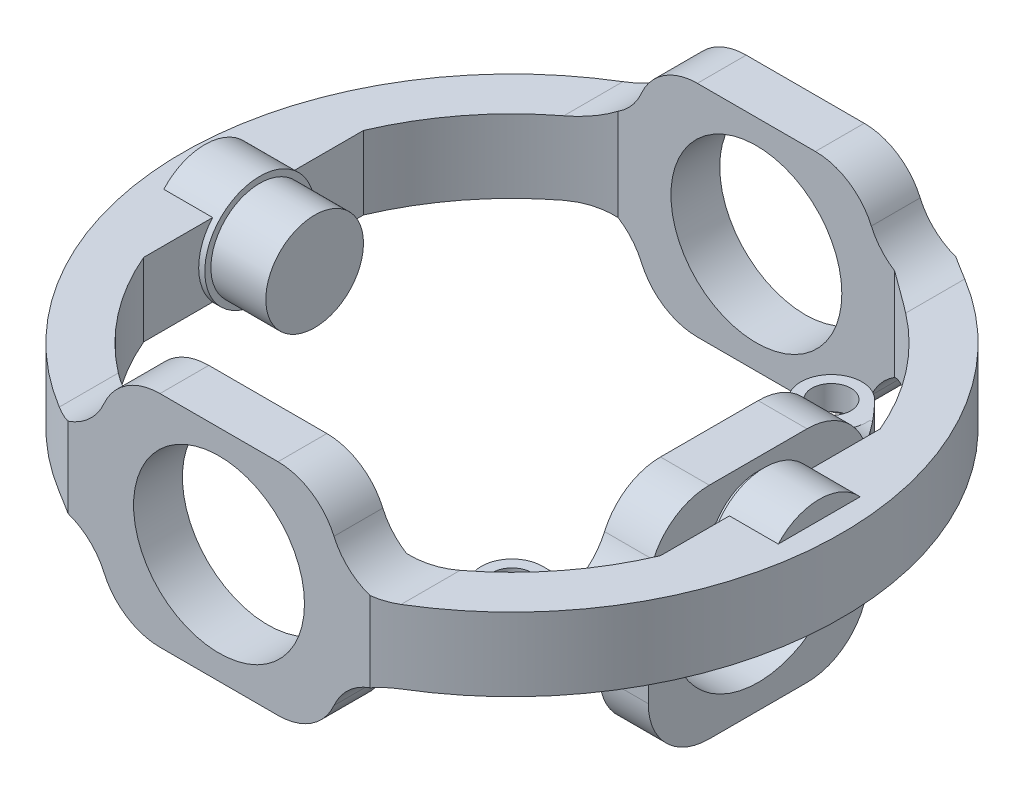
from build123d import *

# Parameters (mm, degrees)
MOTOR_START                                 = -10
MOTOR_BEARING_MOUNT_NO_HORN_FILLET7_OU_W    = 4
MOTOR_BEARING_MOUNT_NO_HORN_FILLET7_OU_H    = 18
MOTOR_BEARING_MOUNT_NO_HORN_FILLET7_DEPTH   = 18
MOTOR_BEARING_MOUNT_NO_HORN_FILLET_2_R      = 1.6
MOTOR_BEARING_MOUNT_NO_HORN_FILLET7_2_DEPTH = 4.233863101
MOTOR_START_2                               = 10
MOTOR_BEARING_MOUNT_NO_HORN_FILLET_3_R      = 7
MOTOR_BEARING_MOUNT_NO_HORN_FILLET7_3_DEPTH = 10.163229875
MOTOR_BEARING_MOUNT_NO_HORN_FILLET7_4_DEPTH = 6.163229875
SKETCH6_R                                   = 27
SKETCH6_R_2                                 = 23
BOSS_EXTRUDE1_DEPTH                         = 6
SKETCH7_R                                   = 4
BOSS_EXTRUDE2_DEPTH                         = 5
SKETCH8_R                                   = 4
BOSS_EXTRUDE3_DEPTH                         = 5
BOSS_EXTRUDE4_DEPTH                         = 0.5
BOSS_EXTRUDE4_DEPTH_BACK                    = 4
SKETCH9_R                                   = 4.5
BOSS_EXTRUDE5_DEPTH                         = 0.5
BOSS_EXTRUDE5_DEPTH_BACK                    = 4
SKETCH10_R                                  = 4.5
BOSS_EXTRUDE6_DEPTH                         = 6
SKETCH12_W                                  = 105.724741705
SKETCH12_H                                  = 65.482936879
SKETCH12_W_2                                = 68.269728532
SKETCH12_H_2                                = 48.01835408
CUT_EXTRUDE1_DEPTH                          = 6
BOSS_EXTRUDE7_DEPTH                         = 6
BOSS_EXTRUDE7_DEPTH_BACK                    = 12
SKETCH13_W                                  = 18
SKETCH13_H                                  = 4
CUT_EXTRUDE2_REACH                          = 58.381
SKETCH14_R                                  = 7
FILLET1_R                                   = 5
FILLET2_R                                   = 5


with BuildPart() as part:
    # <Motor Bearing Mount No Horn>-<Fillet7>: read off the stored shape, not the designer's step
    # <Motor Bearing Mount No Horn>-<Fillet7> ou → <Motor Bearing Mount No Horn>-<Fillet7> (new body)
    with BuildSketch(Plane(origin=(0, 0, 0), x_dir=(1, 0, 0), z_dir=(0, 1, 0)).offset(MOTOR_START)):
        with Locations((18.163229875, 0)):
            Rectangle(MOTOR_BEARING_MOUNT_NO_HORN_FILLET7_OU_W, MOTOR_BEARING_MOUNT_NO_HORN_FILLET7_OU_H)
    extrude(amount=MOTOR_BEARING_MOUNT_NO_HORN_FILLET7_DEPTH)

    # Motor Bearing Mount No Horn_-_Fillet 2 → Motor Bearing Mount No Horn_-_Fillet7 2 (add)
    # profile 1 of 2: a face of its own
    with BuildSketch(Plane(origin=(0, 0, 0), x_dir=(1, 0, 0), z_dir=(0, 1, 0))):
        with BuildLine():
            ThreePointArc((16.861305488, -12.517842356), (18.410904773, -10.663779717), (20.163229875, -9))
            Line((20.163229875, -9), (16.163229875, -9))
            Line((16.163229875, -9), (16.163229875, -7.591593953))
            ThreePointArc((16.163229875, -7.591593953), (16.095478885, -8.411910787), (15.894061993, -9.209996709))
            ThreePointArc((15.894061993, -9.209996709), (15.225402253, -10.14460404), (14.152747844, -10.556925794))
            ThreePointArc((14.152747844, -10.556925794), (13.649049258, -10.582314386), (13.144711232, -10.582275333))
            ThreePointArc((13.144711232, -10.582275333), (10.759860766, -14.008894046), (14.849242405, -14.849242405))
            ThreePointArc((14.849242405, -14.849242405), (15.898068073, -13.720474902), (16.861305488, -12.517842356))
        make_face()
        with Locations((13.081475452, -13.081475452)):
            Circle(MOTOR_BEARING_MOUNT_NO_HORN_FILLET_2_R, mode=Mode.SUBTRACT)
    # profile 2 of 2: a face of its own
    with BuildSketch(Plane(origin=(0, 0, 0), x_dir=(1, 0, 0), z_dir=(0, 1, 0))):
        with BuildLine():
            Line((16.163229875, 9), (20.163229875, 9))
            ThreePointArc((20.163229875, 9), (18.410904773, 10.663779717), (16.861305488, 12.517842356))
            ThreePointArc((16.861305488, 12.517842356), (15.898068073, 13.720474902), (14.849242405, 14.849242405))
            ThreePointArc((14.849242405, 14.849242405), (10.759860766, 14.008894046), (13.144711232, 10.582275333))
            ThreePointArc((13.144711232, 10.582275333), (13.649049258, 10.582314386), (14.152747844, 10.556925794))
            ThreePointArc((14.152747844, 10.556925794), (15.225402253, 10.14460404), (15.894061993, 9.209996709))
            ThreePointArc((15.894061993, 9.209996709), (16.095478885, 8.411910787), (16.163229875, 7.591593953))
            Line((16.163229875, 7.591593953), (16.163229875, 9))
        make_face()
        with Locations((13.081475452, 13.081475452)):
            Circle(MOTOR_BEARING_MOUNT_NO_HORN_FILLET_2_R, mode=Mode.SUBTRACT)
    extrude(amount=MOTOR_BEARING_MOUNT_NO_HORN_FILLET7_2_DEPTH)

    # Motor Bearing Mount No Horn_-_Fillet 3 → Motor Bearing Mount No Horn_-_Fillet7 3 (cut)
    with BuildSketch(Plane.YZ.offset(MOTOR_START_2)):
        with BuildLine():
            Line((2, 17), (2, 13.16515139))
            ThreePointArc((2, 13.16515139), (2.593715587, 10.801963357), (4.23386307, 8.999999954))
            Line((4.23386307, 8.999999954), (4.233863101, 17))
            Line((4.233863101, 17), (2, 17))
        make_face()
        with BuildLine():
            Line((8, 9), (4.23386307, 8.999999954))
            ThreePointArc((4.23386307, 8.999999954), (4.607809359, 8.774545061), (5, 8.582575695))
            ThreePointArc((5, 8.582575695), (7.183300133, 6.738612788), (8, 4))
            Line((8, 4), (8, 9))
        make_face()
        with Locations((-1, 0)):
            Circle(MOTOR_BEARING_MOUNT_NO_HORN_FILLET_3_R)
        with BuildLine():
            ThreePointArc((-10, 4), (-8.535533906, 7.535533906), (-5, 9))
            Line((-5, 9), (-10, 9))
            Line((-10, 9), (-10, 4))
        make_face()
        with BuildLine():
            Line((8, -9), (8, -4))
            ThreePointArc((8, -4), (7.183300133, -6.738612788), (5, -8.582575695))
            ThreePointArc((5, -8.582575695), (4.607809359, -8.774545061), (4.23386307, -8.999999954))
            Line((4.23386307, -8.999999954), (8, -9))
        make_face()
        with BuildLine():
            ThreePointArc((-5, -9), (-8.535533906, -7.535533906), (-10, -4))
            Line((-10, -4), (-10, -9))
            Line((-10, -9), (-5, -9))
        make_face()
        with BuildLine():
            Line((4.233863101, -17), (4.23386307, -8.999999954))
            ThreePointArc((4.23386307, -8.999999954), (2.593715587, -10.801963357), (2, -13.16515139))
            Line((2, -13.16515139), (2, -17))
            Line((2, -17), (4.233863101, -17))
        make_face()
    extrude(amount=MOTOR_BEARING_MOUNT_NO_HORN_FILLET7_3_DEPTH, mode=Mode.SUBTRACT)

    # Motor Bearing Mount No Horn_-_Fillet 4 → Motor Bearing Mount No Horn_-_Fillet7 4 (cut)
    with BuildSketch(Plane.YZ.offset(MOTOR_START_2)):
        with BuildLine():
            ThreePointArc((4.23386307, 8.999999954), (2.593715587, 10.801963357), (2, 13.16515139))
            Line((2, 13.16515139), (2, 6.32455532))
            ThreePointArc((2, 6.32455532), (3.201378916, 5.598965548), (4.233863101, 4.648298295))
            Line((4.233863101, 4.648298295), (4.23386307, 8.999999954))
        make_face()
        with BuildLine():
            ThreePointArc((4.233863101, -4.648298295), (3.201378916, -5.598965548), (2, -6.32455532))
            Line((2, -6.32455532), (2, -13.16515139))
            ThreePointArc((2, -13.16515139), (2.593715587, -10.801963357), (4.23386307, -8.999999954))
            Line((4.23386307, -8.999999954), (4.233863101, -4.648298295))
        make_face()
    extrude(amount=MOTOR_BEARING_MOUNT_NO_HORN_FILLET7_4_DEPTH, mode=Mode.SUBTRACT)


with BuildPart() as body_2:
    # Sketch6 → Boss-Extrude1 (new body)
    # profile 1 of 3: a face of its own
    with BuildSketch(Plane(origin=(0, 0, 0), x_dir=(1, 0, 0), z_dir=(0, 1, 0))):
        with Locations(Location((0, 0, 0), (0, 0, 270))):
            Circle(SKETCH6_R)
        Circle(SKETCH6_R_2, mode=Mode.SUBTRACT)
    # profile 2 of 3: a face of its own
    with BuildSketch(Plane(origin=(0, 0, 0), x_dir=(1, 0, 0), z_dir=(0, 1, 0))):
        with BuildLine():
            Line((-21.166010489, -9), (-21.166010489, 9))
            ThreePointArc((-21.166010489, 9), (-23, 0), (-21.166010489, -9))
        make_face()
    # profile 3 of 3: a face of its own
    with BuildSketch(Plane(origin=(0, 0, 0), x_dir=(1, 0, 0), z_dir=(0, 1, 0))):
        with BuildLine():
            ThreePointArc((23, 0), (22.536839189, 4.592480744), (21.166010489, 9))
            Line((21.166010489, 9), (21.166010489, -9))
            ThreePointArc((21.166010489, -9), (22.536839189, -4.592480744), (23, 0))
        make_face()
    extrude(amount=BOSS_EXTRUDE1_DEPTH)

    # Sketch7 → Boss-Extrude2 (add)
    with BuildSketch(Plane.ZY.offset(-21.166010489)):
        with Locations(Location((0, 3, 0), (0, 0, 131.409622109))):
            Circle(SKETCH7_R)
    extrude(amount=BOSS_EXTRUDE2_DEPTH)

    # Sketch8 → Boss-Extrude3 (add)
    with BuildSketch(Plane(origin=(-21.166010489, 0, 0), x_dir=(0, 0, -1), z_dir=(1, 0, 0))):
        with Locations(Location((0, 3, 0), (0, 0, 48.590377891))):
            Circle(SKETCH8_R)
    extrude(amount=BOSS_EXTRUDE3_DEPTH)

    # Sketch9 → Boss-Extrude4 (add, two sides: drawn at the far end of the back side and taken through both)
    with BuildSketch(Plane(origin=(-21.166010489, 0, 0), x_dir=(0, 0, -1), z_dir=(1, 0, 0)).offset(-BOSS_EXTRUDE4_DEPTH_BACK)):
        with Locations((0, 3)):
            Circle(SKETCH9_R)
    extrude(amount=BOSS_EXTRUDE4_DEPTH + BOSS_EXTRUDE4_DEPTH_BACK)

    # Sketch10 → Boss-Extrude5 (add, two sides: drawn at the far end of the back side and taken through both)
    with BuildSketch(Plane.ZY.offset(-21.166010489).offset(-BOSS_EXTRUDE5_DEPTH_BACK)):
        with Locations(Location((0, 3, 0), (0, 0, 180))):
            Circle(SKETCH10_R)
    extrude(amount=BOSS_EXTRUDE5_DEPTH + BOSS_EXTRUDE5_DEPTH_BACK)

    # Sketch11 → Boss-Extrude6 (add)
    with BuildSketch(Plane(origin=(0, 6, 0), x_dir=(1, 0, 0), z_dir=(0, 1, 0))):
        with BuildLine():
            ThreePointArc((11.325435971, 20.01835408), (0, 23), (-11.325435971, 20.01835408))
            Line((-11.325435971, 20.01835408), (11.325435971, 20.01835408))
        make_face()
        with BuildLine():
            Line((0, -20), (-11.357816692, -20))
            ThreePointArc((-11.357816692, -20), (0, -23), (11.357816692, -20))
            Line((11.357816692, -20), (0, -20))
        make_face()
    extrude(amount=-BOSS_EXTRUDE6_DEPTH)

    # Sketch12 → Cut-Extrude1 (cut)
    with BuildSketch(Plane(origin=(0, 6, 0), x_dir=(1, 0, 0), z_dir=(0, 1, 0))):
        with Locations((2.340104953, -2.120095085)):
            Rectangle(SKETCH12_W, SKETCH12_H)
        with Locations((1.133384165, 0.00917704)):
            Rectangle(SKETCH12_W_2, SKETCH12_H_2, mode=Mode.SUBTRACT)
    extrude(amount=-CUT_EXTRUDE1_DEPTH, mode=Mode.SUBTRACT)

    # Sketch13 → Boss-Extrude7 (add, two sides: drawn at the far end of the back side and taken through both)
    with BuildSketch(Plane(origin=(0, 6, 0), x_dir=(1, 0, 0), z_dir=(0, 1, 0)).offset(-BOSS_EXTRUDE7_DEPTH_BACK)):
        with Locations((0, -22)):
            Rectangle(SKETCH13_W, SKETCH13_H)
        with Locations((0, 22.01835408)):
            Rectangle(SKETCH13_W, SKETCH13_H)
    extrude(amount=BOSS_EXTRUDE7_DEPTH + BOSS_EXTRUDE7_DEPTH_BACK)

    # Cut-Extrude2: up to this face of the body (flat: up to its plane)
    cut_extrude2_end = Plane(body_2.part.faces().sort_by_distance((0, 3, -24.01835408))[0])
    # Sketch14 → Cut-Extrude2 (cut, up to the picked face)
    with BuildSketch(Plane.XY.offset(24), mode=Mode.PRIVATE) as cut_extrude2_sk1:
        with Locations((0, 3)):
            Circle(SKETCH14_R)
    cut_extrude2_tool1 = split(extrude(cut_extrude2_sk1.sketch, amount=-CUT_EXTRUDE2_REACH, mode=Mode.PRIVATE), bisect_by=cut_extrude2_end, keep=Keep.BOTH, mode=Mode.PRIVATE)
    add(cut_extrude2_tool1.solids().sort_by(Axis((0, 3, 24), (0, 0, -1)))[0], mode=Mode.SUBTRACT)

    # Fillet1
    # the kernel refuses this fillet: 5 mm, written as the material it adds along each edge
    with BuildSketch(Plane(origin=(-9, 0, 20), x_dir=(-1, 0, 0), z_dir=(0, 0, 1))) as fillet1_piece_1_section:
        with BuildLine():
            CenterArc((FILLET1_R, FILLET1_R), FILLET1_R, 180, 90)
            Line((0, FILLET1_R), (0, 0))
            Line((0, 0), (FILLET1_R, 0))
        make_face()
    fillet1_piece_1 = extrude(amount=4, mode=Mode.PRIVATE)
    fillet1_piece_1 = fillet1_piece_1 & Plane(origin=(0, 0, 0), x_dir=(1, 0, 0), z_dir=(0, -1, 0)) * Cylinder(23, 28, mode=Mode.PRIVATE)
    add(fillet1_piece_1)
    with BuildSketch(Plane(origin=(-9, 0, 7.5), x_dir=(-1, 0, 0), z_dir=(0, 0, 1))) as fillet1_piece_2_section:
        with BuildLine():
            CenterArc((FILLET1_R, FILLET1_R), FILLET1_R, 180, 90)
            Line((0, FILLET1_R), (0, 0))
            Line((0, 0), (FILLET1_R, 0))
        make_face()
    fillet1_piece_2 = extrude(amount=16.5, mode=Mode.PRIVATE)
    fillet1_piece_2 = split(fillet1_piece_2, bisect_by=Plane(origin=(-9, 0, 20), z_dir=(0, 0, -1)), keep=Keep.TOP, mode=Mode.PRIVATE)
    fillet1_piece_2 = fillet1_piece_2 - Plane(origin=(0, 0, 0), x_dir=(1, 0, 0), z_dir=(0, -1, 0)) * Cylinder(23, 53, mode=Mode.PRIVATE)
    add(fillet1_piece_2)
    with BuildSketch(Plane(origin=(-9, 0, 20), x_dir=(-1, 0, 0), z_dir=(0, 0, 1))) as fillet1_piece_3_section:
        with BuildLine():
            CenterArc((FILLET1_R, FILLET1_R), FILLET1_R, 180, 90)
            Line((0, FILLET1_R), (0, 0))
            Line((0, 0), (FILLET1_R, 0))
        make_face()
    fillet1_piece_3 = extrude(amount=4, mode=Mode.PRIVATE)
    fillet1_piece_3 = fillet1_piece_3 & Plane(origin=(0, 0, 0), x_dir=(0, 0, 1), z_dir=(0, -1, 0)) * Cylinder(27, 28, mode=Mode.PRIVATE)
    fillet1_piece_3 = fillet1_piece_3 - Plane(origin=(0, 0, 0), x_dir=(1, 0, 0), z_dir=(0, -1, 0)) * Cylinder(23, 28, mode=Mode.PRIVATE)
    add(fillet1_piece_3)
    with BuildSketch(Plane(origin=(9, 0, 24), x_dir=(1, 0, 0), z_dir=(0, 0, -1))) as fillet1_piece_4_section:
        with BuildLine():
            CenterArc((FILLET1_R, FILLET1_R), FILLET1_R, 180, 90)
            Line((0, FILLET1_R), (0, 0))
            Line((0, 0), (FILLET1_R, 0))
        make_face()
    fillet1_piece_4 = extrude(amount=4, mode=Mode.PRIVATE)
    fillet1_piece_4 = fillet1_piece_4 & Plane(origin=(0, 0, 0), x_dir=(0, 0, 1), z_dir=(0, -1, 0)) * Cylinder(27, 28, mode=Mode.PRIVATE)
    fillet1_piece_4 = fillet1_piece_4 - Plane(origin=(0, 0, 0), x_dir=(1, 0, 0), z_dir=(0, -1, 0)) * Cylinder(23, 28, mode=Mode.PRIVATE)
    add(fillet1_piece_4)
    with BuildSketch(Plane(origin=(9, 0, 24), x_dir=(1, 0, 0), z_dir=(0, 0, -1))) as fillet1_piece_5_section:
        with BuildLine():
            CenterArc((FILLET1_R, FILLET1_R), FILLET1_R, 180, 90)
            Line((0, FILLET1_R), (0, 0))
            Line((0, 0), (FILLET1_R, 0))
        make_face()
    fillet1_piece_5 = extrude(amount=4, mode=Mode.PRIVATE)
    fillet1_piece_5 = fillet1_piece_5 & Plane(origin=(0, 0, 0), x_dir=(1, 0, 0), z_dir=(0, -1, 0)) * Cylinder(23, 28, mode=Mode.PRIVATE)
    add(fillet1_piece_5)
    with BuildSketch(Plane(origin=(9, 0, 24), x_dir=(1, 0, 0), z_dir=(0, 0, -1))) as fillet1_piece_6_section:
        with BuildLine():
            CenterArc((FILLET1_R, FILLET1_R), FILLET1_R, 180, 90)
            Line((0, FILLET1_R), (0, 0))
            Line((0, 0), (FILLET1_R, 0))
        make_face()
    fillet1_piece_6 = extrude(amount=16.5, mode=Mode.PRIVATE)
    fillet1_piece_6 = split(fillet1_piece_6, bisect_by=Plane(origin=(9, 0, 20), z_dir=(0, 0, -1)), keep=Keep.TOP, mode=Mode.PRIVATE)
    fillet1_piece_6 = fillet1_piece_6 - Plane(origin=(0, 0, 0), x_dir=(1, 0, 0), z_dir=(0, -1, 0)) * Cylinder(23, 53, mode=Mode.PRIVATE)
    add(fillet1_piece_6)
    with BuildSketch(Plane(origin=(-9, 6, 20), x_dir=(-1, 0, 0), z_dir=(0, 0, 1))) as fillet1_piece_7_section:
        with BuildLine():
            CenterArc((FILLET1_R, -FILLET1_R), FILLET1_R, 90, 90)
            Line((0, -FILLET1_R), (0, 0))
            Line((0, 0), (FILLET1_R, 0))
        make_face()
    fillet1_piece_7 = extrude(amount=4, mode=Mode.PRIVATE)
    fillet1_piece_7 = fillet1_piece_7 & Plane(origin=(0, 6, 0), x_dir=(1, 0, 0), z_dir=(0, -1, 0)) * Cylinder(23, 28, mode=Mode.PRIVATE)
    add(fillet1_piece_7)
    with BuildSketch(Plane(origin=(-9, 6, 7.5), x_dir=(-1, 0, 0), z_dir=(0, 0, 1))) as fillet1_piece_8_section:
        with BuildLine():
            CenterArc((FILLET1_R, -FILLET1_R), FILLET1_R, 90, 90)
            Line((0, -FILLET1_R), (0, 0))
            Line((0, 0), (FILLET1_R, 0))
        make_face()
    fillet1_piece_8 = extrude(amount=16.5, mode=Mode.PRIVATE)
    fillet1_piece_8 = split(fillet1_piece_8, bisect_by=Plane(origin=(-9, 6, 20), z_dir=(0, 0, -1)), keep=Keep.TOP, mode=Mode.PRIVATE)
    fillet1_piece_8 = fillet1_piece_8 - Plane(origin=(0, 6, 0), x_dir=(1, 0, 0), z_dir=(0, -1, 0)) * Cylinder(23, 53, mode=Mode.PRIVATE)
    add(fillet1_piece_8)
    with BuildSketch(Plane(origin=(-9, 6, 20), x_dir=(-1, 0, 0), z_dir=(0, 0, 1))) as fillet1_piece_9_section:
        with BuildLine():
            CenterArc((FILLET1_R, -FILLET1_R), FILLET1_R, 90, 90)
            Line((0, -FILLET1_R), (0, 0))
            Line((0, 0), (FILLET1_R, 0))
        make_face()
    fillet1_piece_9 = extrude(amount=4, mode=Mode.PRIVATE)
    fillet1_piece_9 = fillet1_piece_9 & Plane(origin=(0, 6, 0), x_dir=(0, 0, 1), z_dir=(0, -1, 0)) * Cylinder(27, 28, mode=Mode.PRIVATE)
    fillet1_piece_9 = fillet1_piece_9 - Plane(origin=(0, 6, 0), x_dir=(1, 0, 0), z_dir=(0, -1, 0)) * Cylinder(23, 28, mode=Mode.PRIVATE)
    add(fillet1_piece_9)
    with BuildSketch(Plane(origin=(9, 6, 24), x_dir=(1, 0, 0), z_dir=(0, 0, -1))) as fillet1_piece_10_section:
        with BuildLine():
            CenterArc((FILLET1_R, -FILLET1_R), FILLET1_R, 90, 90)
            Line((0, -FILLET1_R), (0, 0))
            Line((0, 0), (FILLET1_R, 0))
        make_face()
    fillet1_piece_10 = extrude(amount=4, mode=Mode.PRIVATE)
    fillet1_piece_10 = fillet1_piece_10 & Plane(origin=(0, 6, 0), x_dir=(0, 0, 1), z_dir=(0, -1, 0)) * Cylinder(27, 28, mode=Mode.PRIVATE)
    fillet1_piece_10 = fillet1_piece_10 - Plane(origin=(0, 6, 0), x_dir=(1, 0, 0), z_dir=(0, -1, 0)) * Cylinder(23, 28, mode=Mode.PRIVATE)
    add(fillet1_piece_10)
    with BuildSketch(Plane(origin=(9, 6, 24), x_dir=(1, 0, 0), z_dir=(0, 0, -1))) as fillet1_piece_11_section:
        with BuildLine():
            CenterArc((FILLET1_R, -FILLET1_R), FILLET1_R, 90, 90)
            Line((0, -FILLET1_R), (0, 0))
            Line((0, 0), (FILLET1_R, 0))
        make_face()
    fillet1_piece_11 = extrude(amount=4, mode=Mode.PRIVATE)
    fillet1_piece_11 = fillet1_piece_11 & Plane(origin=(0, 6, 0), x_dir=(1, 0, 0), z_dir=(0, -1, 0)) * Cylinder(23, 28, mode=Mode.PRIVATE)
    add(fillet1_piece_11)
    with BuildSketch(Plane(origin=(9, 6, 24), x_dir=(1, 0, 0), z_dir=(0, 0, -1))) as fillet1_piece_12_section:
        with BuildLine():
            CenterArc((FILLET1_R, -FILLET1_R), FILLET1_R, 90, 90)
            Line((0, -FILLET1_R), (0, 0))
            Line((0, 0), (FILLET1_R, 0))
        make_face()
    fillet1_piece_12 = extrude(amount=16.5, mode=Mode.PRIVATE)
    fillet1_piece_12 = split(fillet1_piece_12, bisect_by=Plane(origin=(9, 6, 20), z_dir=(0, 0, -1)), keep=Keep.TOP, mode=Mode.PRIVATE)
    fillet1_piece_12 = fillet1_piece_12 - Plane(origin=(0, 6, 0), x_dir=(1, 0, 0), z_dir=(0, -1, 0)) * Cylinder(23, 53, mode=Mode.PRIVATE)
    add(fillet1_piece_12)
    with BuildSketch(Plane(origin=(-9, 0, -24.01835408), x_dir=(0, -1, 0), z_dir=(0, 0, 1))) as fillet1_piece_13_section:
        with BuildLine():
            CenterArc((FILLET1_R, -FILLET1_R), FILLET1_R, 90, 90)
            Line((0, -FILLET1_R), (0, 0))
            Line((0, 0), (FILLET1_R, 0))
        make_face()
    fillet1_piece_13 = extrude(amount=4, mode=Mode.PRIVATE)
    fillet1_piece_13 = fillet1_piece_13 & Plane(origin=(0, 0, 0), x_dir=(0, 0, 1), z_dir=(0, -1, 0)) * Cylinder(27, 28, mode=Mode.PRIVATE)
    fillet1_piece_13 = fillet1_piece_13 - Plane(origin=(0, 0, 0), x_dir=(1, 0, 0), z_dir=(0, -1, 0)) * Cylinder(23, 28, mode=Mode.PRIVATE)
    add(fillet1_piece_13)
    with BuildSketch(Plane(origin=(-9, 0, -24.01835408), x_dir=(0, -1, 0), z_dir=(0, 0, 1))) as fillet1_piece_14_section:
        with BuildLine():
            CenterArc((FILLET1_R, -FILLET1_R), FILLET1_R, 90, 90)
            Line((0, -FILLET1_R), (0, 0))
            Line((0, 0), (FILLET1_R, 0))
        make_face()
    fillet1_piece_14 = extrude(amount=16.5, mode=Mode.PRIVATE)
    fillet1_piece_14 = split(fillet1_piece_14, bisect_by=Plane(origin=(-9, 0, -20.01835408), z_dir=(0, 0, 1)), keep=Keep.TOP, mode=Mode.PRIVATE)
    fillet1_piece_14 = fillet1_piece_14 - Plane(origin=(0, 0, 0), x_dir=(1, 0, 0), z_dir=(0, -1, 0)) * Cylinder(23, 53, mode=Mode.PRIVATE)
    add(fillet1_piece_14)
    with BuildSketch(Plane(origin=(-9, 0, -24.01835408), x_dir=(0, -1, 0), z_dir=(0, 0, 1))) as fillet1_piece_15_section:
        with BuildLine():
            CenterArc((FILLET1_R, -FILLET1_R), FILLET1_R, 90, 90)
            Line((0, -FILLET1_R), (0, 0))
            Line((0, 0), (FILLET1_R, 0))
        make_face()
    fillet1_piece_15 = extrude(amount=4, mode=Mode.PRIVATE)
    fillet1_piece_15 = fillet1_piece_15 & Plane(origin=(0, 0, 0), x_dir=(1, 0, 0), z_dir=(0, -1, 0)) * Cylinder(23, 28, mode=Mode.PRIVATE)
    add(fillet1_piece_15)
    with BuildSketch(Plane(origin=(9, 0, -20.01835408), x_dir=(1, 0, 0), z_dir=(0, 0, -1))) as fillet1_piece_16_section:
        with BuildLine():
            CenterArc((FILLET1_R, FILLET1_R), FILLET1_R, 180, 90)
            Line((0, FILLET1_R), (0, 0))
            Line((0, 0), (FILLET1_R, 0))
        make_face()
    fillet1_piece_16 = extrude(amount=4, mode=Mode.PRIVATE)
    fillet1_piece_16 = fillet1_piece_16 & Plane(origin=(0, 0, 0), x_dir=(1, 0, 0), z_dir=(0, -1, 0)) * Cylinder(23, 28, mode=Mode.PRIVATE)
    add(fillet1_piece_16)
    with BuildSketch(Plane(origin=(9, 0, -7.51835408), x_dir=(1, 0, 0), z_dir=(0, 0, -1))) as fillet1_piece_17_section:
        with BuildLine():
            CenterArc((FILLET1_R, FILLET1_R), FILLET1_R, 180, 90)
            Line((0, FILLET1_R), (0, 0))
            Line((0, 0), (FILLET1_R, 0))
        make_face()
    fillet1_piece_17 = extrude(amount=16.5, mode=Mode.PRIVATE)
    fillet1_piece_17 = fillet1_piece_17 - Plane(origin=(0, 0, 0), x_dir=(1, 0, 0), z_dir=(0, -1, 0)) * Cylinder(23, 53, mode=Mode.PRIVATE)
    fillet1_piece_17 = split(fillet1_piece_17, bisect_by=Plane(origin=(9, 0, -20.01835408), z_dir=(0, 0, 1)), keep=Keep.TOP, mode=Mode.PRIVATE)
    add(fillet1_piece_17)
    with BuildSketch(Plane(origin=(9, 0, -20.01835408), x_dir=(1, 0, 0), z_dir=(0, 0, -1))) as fillet1_piece_18_section:
        with BuildLine():
            CenterArc((FILLET1_R, FILLET1_R), FILLET1_R, 180, 90)
            Line((0, FILLET1_R), (0, 0))
            Line((0, 0), (FILLET1_R, 0))
        make_face()
    fillet1_piece_18 = extrude(amount=4, mode=Mode.PRIVATE)
    fillet1_piece_18 = fillet1_piece_18 & Plane(origin=(0, 0, 0), x_dir=(0, 0, 1), z_dir=(0, -1, 0)) * Cylinder(27, 28, mode=Mode.PRIVATE)
    fillet1_piece_18 = fillet1_piece_18 - Plane(origin=(0, 0, 0), x_dir=(1, 0, 0), z_dir=(0, -1, 0)) * Cylinder(23, 28, mode=Mode.PRIVATE)
    add(fillet1_piece_18)
    with BuildSketch(Plane(origin=(-9, 6, -24.01835408), x_dir=(0, 1, 0), z_dir=(0, 0, 1))) as fillet1_piece_19_section:
        with BuildLine():
            CenterArc((FILLET1_R, FILLET1_R), FILLET1_R, 180, 90)
            Line((0, FILLET1_R), (0, 0))
            Line((0, 0), (FILLET1_R, 0))
        make_face()
    fillet1_piece_19 = extrude(amount=4, mode=Mode.PRIVATE)
    fillet1_piece_19 = fillet1_piece_19 & Plane(origin=(0, 6, 0), x_dir=(0, 0, 1), z_dir=(0, -1, 0)) * Cylinder(27, 28, mode=Mode.PRIVATE)
    fillet1_piece_19 = fillet1_piece_19 - Plane(origin=(0, 6, 0), x_dir=(1, 0, 0), z_dir=(0, -1, 0)) * Cylinder(23, 28, mode=Mode.PRIVATE)
    add(fillet1_piece_19)
    with BuildSketch(Plane(origin=(-9, 6, -24.01835408), x_dir=(0, 1, 0), z_dir=(0, 0, 1))) as fillet1_piece_20_section:
        with BuildLine():
            CenterArc((FILLET1_R, FILLET1_R), FILLET1_R, 180, 90)
            Line((0, FILLET1_R), (0, 0))
            Line((0, 0), (FILLET1_R, 0))
        make_face()
    fillet1_piece_20 = extrude(amount=16.5, mode=Mode.PRIVATE)
    fillet1_piece_20 = split(fillet1_piece_20, bisect_by=Plane(origin=(-9, 6, -20.01835408), z_dir=(0, 0, 1)), keep=Keep.TOP, mode=Mode.PRIVATE)
    fillet1_piece_20 = fillet1_piece_20 - Plane(origin=(0, 6, 0), x_dir=(1, 0, 0), z_dir=(0, -1, 0)) * Cylinder(23, 53, mode=Mode.PRIVATE)
    add(fillet1_piece_20)
    with BuildSketch(Plane(origin=(-9, 6, -24.01835408), x_dir=(0, 1, 0), z_dir=(0, 0, 1))) as fillet1_piece_21_section:
        with BuildLine():
            CenterArc((FILLET1_R, FILLET1_R), FILLET1_R, 180, 90)
            Line((0, FILLET1_R), (0, 0))
            Line((0, 0), (FILLET1_R, 0))
        make_face()
    fillet1_piece_21 = extrude(amount=4, mode=Mode.PRIVATE)
    fillet1_piece_21 = fillet1_piece_21 & Plane(origin=(0, 6, 0), x_dir=(1, 0, 0), z_dir=(0, -1, 0)) * Cylinder(23, 28, mode=Mode.PRIVATE)
    add(fillet1_piece_21)
    with BuildSketch(Plane(origin=(9, 6, -20.01835408), x_dir=(1, 0, 0), z_dir=(0, 0, -1))) as fillet1_piece_22_section:
        with BuildLine():
            CenterArc((FILLET1_R, -FILLET1_R), FILLET1_R, 90, 90)
            Line((0, -FILLET1_R), (0, 0))
            Line((0, 0), (FILLET1_R, 0))
        make_face()
    fillet1_piece_22 = extrude(amount=4, mode=Mode.PRIVATE)
    fillet1_piece_22 = fillet1_piece_22 & Plane(origin=(0, 6, 0), x_dir=(1, 0, 0), z_dir=(0, -1, 0)) * Cylinder(23, 28, mode=Mode.PRIVATE)
    add(fillet1_piece_22)
    with BuildSketch(Plane(origin=(9, 6, -7.51835408), x_dir=(1, 0, 0), z_dir=(0, 0, -1))) as fillet1_piece_23_section:
        with BuildLine():
            CenterArc((FILLET1_R, -FILLET1_R), FILLET1_R, 90, 90)
            Line((0, -FILLET1_R), (0, 0))
            Line((0, 0), (FILLET1_R, 0))
        make_face()
    fillet1_piece_23 = extrude(amount=16.5, mode=Mode.PRIVATE)
    fillet1_piece_23 = fillet1_piece_23 - Plane(origin=(0, 6, 0), x_dir=(1, 0, 0), z_dir=(0, -1, 0)) * Cylinder(23, 53, mode=Mode.PRIVATE)
    fillet1_piece_23 = split(fillet1_piece_23, bisect_by=Plane(origin=(9, 6, -20.01835408), z_dir=(0, 0, 1)), keep=Keep.TOP, mode=Mode.PRIVATE)
    add(fillet1_piece_23)
    with BuildSketch(Plane(origin=(9, 6, -20.01835408), x_dir=(1, 0, 0), z_dir=(0, 0, -1))) as fillet1_piece_24_section:
        with BuildLine():
            CenterArc((FILLET1_R, -FILLET1_R), FILLET1_R, 90, 90)
            Line((0, -FILLET1_R), (0, 0))
            Line((0, 0), (FILLET1_R, 0))
        make_face()
    fillet1_piece_24 = extrude(amount=4, mode=Mode.PRIVATE)
    fillet1_piece_24 = fillet1_piece_24 & Plane(origin=(0, 6, 0), x_dir=(0, 0, 1), z_dir=(0, -1, 0)) * Cylinder(27, 28, mode=Mode.PRIVATE)
    fillet1_piece_24 = fillet1_piece_24 - Plane(origin=(0, 6, 0), x_dir=(1, 0, 0), z_dir=(0, -1, 0)) * Cylinder(23, 28, mode=Mode.PRIVATE)
    add(fillet1_piece_24)

    # Fillet2
    fillet2_edges = [body_2.edges().sort_by_distance(p)[0] for p in [
        (-9, -6, 22),
        (9, -6, 22),
        (9, -6, -22.01835408),
        (-9, -6, -22.01835408),
        (9, 12, -22.01835408),
        (-9, 12, -22.01835408),
        (9, 12, 22),
        (-9, 12, 22),
    ]]
    fillet(fillet2_edges, radius=FILLET2_R)


solid = Compound([part.part, body_2.part])
